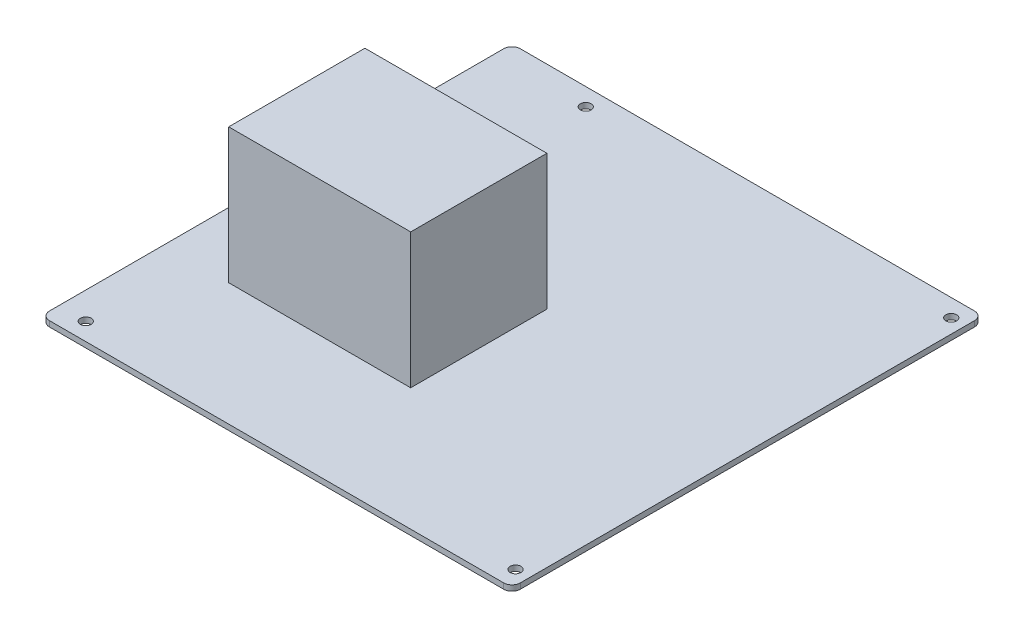
from build123d import *

# Parameters (mm, degrees)
SKETCH1_W                      = 170.18
SKETCH1_H                      = 170.18
BOSS_EXTRUDE1_DEPTH            = 2
SKETCH2_W                      = 65.763909652
SKETCH2_H                      = 49.218222442
BOSS_EXTRUDE2_DEPTH            = 48.8
FILLET1_R                      = 3
F_3_9_3_9_DIAMETER_HOLE1_D     = 3.9
F_3_9_3_9_DIAMETER_HOLE1_DEPTH = 18.75
F_3_9_3_9_DIAMETER_HOLE1_TIP   = 1.171678207


with BuildPart() as part:
    # Sketch1 → Boss-Extrude1 (new body)
    with BuildSketch(Plane(origin=(0, 0, 0), x_dir=(1, 0, 0), z_dir=(0, 1, 0))):
        Rectangle(SKETCH1_W, SKETCH1_H)
    extrude(amount=BOSS_EXTRUDE1_DEPTH)

    # Sketch2 → Boss-Extrude2 (add)
    with BuildSketch(Plane(origin=(0, 2, 0), x_dir=(1, 0, 0), z_dir=(0, 1, 0))):
        with Locations((-28.654354358, -16.233672209)):
            Rectangle(SKETCH2_W, SKETCH2_H)
    extrude(amount=BOSS_EXTRUDE2_DEPTH)

    # Fillet1
    fillet1_edges = [part.edges().sort_by_distance(p)[0] for p in [
        (-85.09, 1, -85.09),
        (85.09, 1, -85.09),
        (85.09, 1, 85.09),
        (-85.09, 1, 85.09),
    ]]
    fillet(fillet1_edges, radius=FILLET1_R)

    # Ø3.9 (3.9) Diameter Hole1
    with Locations(Plane(origin=(0, 2, 0), x_dir=(1, 0, 0), z_dir=(0, 1, 0))):
        with Locations((-75.29, -78.74), (80.01, -78.74), (80.01, 78.74), (-52.07, 78.74)):
            Hole(F_3_9_3_9_DIAMETER_HOLE1_D / 2, depth=F_3_9_3_9_DIAMETER_HOLE1_DEPTH)
            with Locations((0, 0, -(F_3_9_3_9_DIAMETER_HOLE1_DEPTH + F_3_9_3_9_DIAMETER_HOLE1_TIP / 2))):  # 118° drill point
                Cone(0, F_3_9_3_9_DIAMETER_HOLE1_D / 2, F_3_9_3_9_DIAMETER_HOLE1_TIP, mode=Mode.SUBTRACT)


solid = part.part
